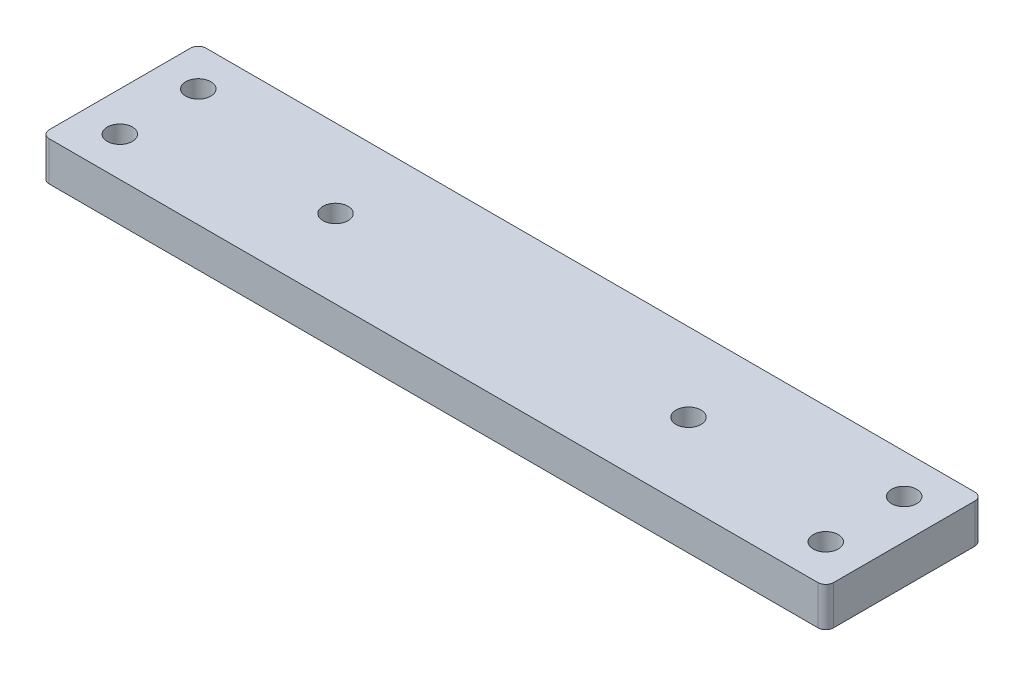
from build123d import *

# Parameters (mm, degrees)
ESQUISSE1_W                     = 100
ESQUISSE1_H                     = 20
BOSS_EXTRU_1_DEPTH              = 5
DIAM_TRE_DU_PER_AGE_3_2_3_2_1_D = 3.2
DIAM_TRE_DU_PER_AGE_3_2_3_2_2_D = 3.2
CONG_1_R                        = 1


with BuildPart() as part:
    # Esquisse1 → Boss.-Extru.1 (new body)
    with BuildSketch(Plane(origin=(0, 5, 0), x_dir=(1, 0, 0), z_dir=(0, 1, 0))):
        with Locations((0, -10)):
            Rectangle(ESQUISSE1_W, ESQUISSE1_H)
    extrude(amount=-BOSS_EXTRU_1_DEPTH)

    # Diamètre du perçage Ø3.2 (3.2)1 (through all)
    with Locations(Plane(origin=(0, 5, 0), x_dir=(1, 0, 0), z_dir=(0, 1, 0))):
        with Locations((22.5, -10), (-22.5, -10)):
            Hole(DIAM_TRE_DU_PER_AGE_3_2_3_2_1_D / 2)

    # Diamètre du perçage Ø3.2 (3.2)2 (through all)
    with Locations(Plane(origin=(0, 0, 0), x_dir=(-1, 0, 0), z_dir=(0, -1, 0))):
        with Locations((45, -15), (45, -5), (-45, -5), (-45, -15)):
            Hole(DIAM_TRE_DU_PER_AGE_3_2_3_2_2_D / 2)

    # Congé1
    cong_1_edges = [part.edges().sort_by_distance(p)[0] for p in [
        (50, 2.5, 0),
        (-50, 2.5, 20),
        (50, 2.5, 20),
        (-50, 2.5, 0),
    ]]
    fillet(cong_1_edges, radius=CONG_1_R)


solid = part.part
